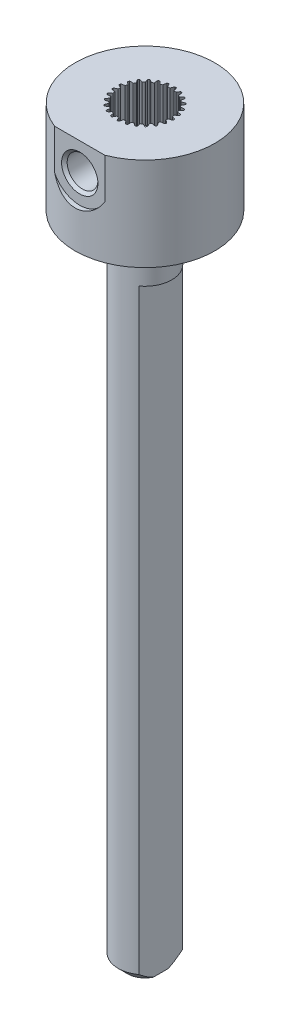
from build123d import *

# Parameters (mm, degrees)
SKETCH1_R               = 2.875
BOSS_EXTRUDE1_DEPTH     = 35
CHAMFER1_SIZE           = 1
SKETCH2_R               = 7.5
BOSS_EXTRUDE2_DEPTH     = 10
SKETCH3_R               = 2.5
CUT_EXTRUDE1_DEPTH      = 6
CUT_EXTRUDE3_DEPTH      = 3
CUT_EXTRUDE2_REACH      = 50.862
CUT_EXTRUDE2_END_RADIUS = 2.5
SKETCH4_R               = 1.65
CHAMFER2_SIZE           = 0.3
CUT_EXTRUDE4_REACH      = 82.7
SKETCH6_R               = 2
BOSS_EXTRUDE3_DEPTH     = 2.5
CUT_EXTRUDE5_START      = -65
CUT_EXTRUDE5_DEPTH      = 65


with BuildPart() as part:
    # Sketch1 → Boss-Extrude1 (new, symmetric)
    with BuildSketch(Plane(origin=(0, 0, 0), x_dir=(1, 0, 0), z_dir=(0, 1, 0))):
        with Locations(Location((0, 0, 0), (0, 0, 270))):
            Circle(SKETCH1_R)
    extrude(amount=BOSS_EXTRUDE1_DEPTH, both=True)

    # Chamfer1
    chamfer1_edges = [part.edges().sort_by_distance(p)[0] for p in [
        (0, -35, -2.875),
    ]]
    chamfer(chamfer1_edges, length=CHAMFER1_SIZE)

    # Sketch2 → Boss-Extrude2 (add)
    with BuildSketch(Plane(origin=(0, 35, 0), x_dir=(1, 0, 0), z_dir=(0, 1, 0))):
        with Locations(Location((0, 0, 0), (0, 0, 270))):
            Circle(SKETCH2_R)
    extrude(amount=BOSS_EXTRUDE2_DEPTH)

    # Sketch3 → Cut-Extrude1 (cut)
    with BuildSketch(Plane(origin=(0, 45, 0), x_dir=(1, 0, 0), z_dir=(0, 1, 0))):
        with Locations(Location((0, 0, 0), (0, 0, 270))):
            Circle(SKETCH3_R)
    extrude(amount=-CUT_EXTRUDE1_DEPTH, mode=Mode.SUBTRACT)

    # Sketch5 → Cut-Extrude3 (cut)
    with BuildSketch(Plane.XY.offset(10)):
        with BuildLine():
            Line((-3, 42), (-3, 45))
            Line((-3, 45), (3, 45))
            Line((3, 45), (3, 42))
            ThreePointArc((3, 42), (0, 39), (-3, 42))
        make_face()
    extrude(amount=-CUT_EXTRUDE3_DEPTH, mode=Mode.SUBTRACT)

    # Cut-Extrude2: up to this cylinder (the profile starts outside it)
    cut_extrude2_end = Plane(origin=(0, 42, 0), z_dir=(0, 1, 0)) * Cylinder(CUT_EXTRUDE2_END_RADIUS, 107.724, mode=Mode.PRIVATE)
    # Sketch4 → Cut-Extrude2 (cut, up to the surface)
    with BuildSketch(Plane.XY.offset(10), mode=Mode.PRIVATE) as cut_extrude2_sk1:
        with Locations((0, 42)):
            Circle(SKETCH4_R)
    cut_extrude2_tool1 = extrude(cut_extrude2_sk1.sketch, amount=-CUT_EXTRUDE2_REACH, mode=Mode.PRIVATE) - cut_extrude2_end
    add(cut_extrude2_tool1.solids().sort_by_distance((0, 42, 10))[0], mode=Mode.SUBTRACT)

    # Chamfer2
    chamfer2_edges = [part.edges().sort_by_distance(p)[0] for p in [
        (-1.65, 42, 7),
    ]]
    chamfer(chamfer2_edges, length=CHAMFER2_SIZE)

    # Cut-Extrude4: up to this face of the body (flat: up to its plane)
    cut_extrude4_end = Plane(part.part.faces().sort_by_distance((0, 39, 0))[0])
    # Sketch7 → Cut-Extrude4 (cut, up to the picked face)
    with BuildSketch(Plane(origin=(0, 45, 0), x_dir=(1, 0, 0), z_dir=(0, 1, 0)), mode=Mode.PRIVATE) as cut_extrude4_sk1:
        Polygon((2.739118864, 0.491293106), (2.792585596, 0.516945827), (2.825867273, 0.535938003), (2.851791156, 0.551403027), (2.897085891, 0.581198263), (2.914141718, 0.59350815), (2.964519237, 0.631435083), (2.99237072, 0.654993582), (3.037784492, 0.693915657), (3.024975426, 0.747757615), (3.011211008, 0.801362185), (2.996497184, 0.854716908), (2.937931607, 0.866950275), (2.902197706, 0.874172775), (2.839774932, 0.883139998), (2.818919353, 0.885707462), (2.764896975, 0.889992876), (2.734787159, 0.891050486), (2.696521666, 0.891653411), (2.637179346, 0.888390957), (2.595856806, 0.882788797), (2.565588962, 0.967204), (2.532576983, 1.05058342), (2.496855049, 1.132840442), (2.530800572, 1.157028788), (2.576209131, 1.195172525), (2.603721042, 1.221844593), (2.624981653, 1.243268006), (2.661447653, 1.283395257), (2.674902463, 1.299555537), (2.714268958, 1.348825164), (2.735384641, 1.378567498), (2.769692044, 1.427560741), (2.743895065, 1.476525632), (2.717232622, 1.525024646), (2.689712869, 1.573042496), (2.629959325, 1.570327587), (2.593535299, 1.56843561), (2.530852926, 1.561598152), (2.510006061, 1.558897381), (2.456617116, 1.549613642), (2.427184416, 1.543148737), (2.389975844, 1.534217696), (2.333309345, 1.516299887), (2.294679788, 1.500597398), (2.244368588, 1.574833227), (2.191657099, 1.647383907), (2.136601301, 1.71817224), (2.163464315, 1.750042634), (2.197960002, 1.798280546), (2.217975246, 1.830956705), (2.233242221, 1.856997777), (2.258580076, 1.904927859), (2.267597982, 1.923936334), (2.293470042, 1.981435367), (2.306527784, 2.015499509), (2.327572823, 2.071485409), (2.290409498, 2.112496464), (2.252523426, 2.152841318), (2.213927295, 2.192506603), (2.156731149, 2.175018667), (2.121914979, 2.164125797), (2.062904258, 2.141915176), (2.043382598, 2.134114239), (1.993980941, 2.111845282), (1.96708219, 2.09826458), (1.933262489, 2.080359972), (1.882832042, 2.048912536), (1.849320151, 2.024096608), (1.782128337, 2.083488162), (1.713030386, 2.140651069), (1.642100321, 2.195523492), (1.660193332, 2.233073249), (1.681608922, 2.288374426), (1.69286881, 2.325001537), (1.701179652, 2.354020218), (1.713802473, 2.406747315), (1.717806891, 2.427385004), (1.72857019, 2.489535841), (1.732744912, 2.525768525), (1.73920589, 2.585229066), (1.693011421, 2.615709872), (1.646282134, 2.645364996), (1.599034305, 2.674185621), (1.547984497, 2.643023188), (1.516971254, 2.623814234), (1.465340142, 2.587628096), (1.448365643, 2.575212848), (1.406059109, 2.541361299), (1.383380438, 2.521516103), (1.355075754, 2.495763885), (1.314050426, 2.452762859), (1.287763791, 2.420392392), (1.20791197, 2.46120836), (1.126769214, 2.499391193), (1.044422222, 2.534900251), (1.052608706, 2.575769965), (1.059599071, 2.634659357), (1.061396041, 2.672936268), (1.062228842, 2.703107688), (1.061341673, 2.757323837), (1.06008836, 2.778301487), (1.055057892, 2.841179002), (1.050090977, 2.87731256), (1.041562163, 2.936511971), (0.989237299, 2.954546664), (0.936600791, 2.971649283), (0.88366978, 2.987814191), (0.841967755, 2.944929204), (0.816712029, 2.918617285), (0.775698674, 2.870723035), (0.762352845, 2.854486157), (0.729787533, 2.811169541), (0.712758373, 2.786309548), (0.691748794, 2.754328105), (0.662705034, 2.702475508), (0.645295038, 2.664584693), (0.557802405, 2.684260147), (0.469712635, 2.701063972), (0.381121496, 2.714978326), (0.378886519, 2.756600112), (0.371012633, 2.815377818), (0.363233217, 2.852899854), (0.356537877, 2.882324575), (0.342194864, 2.934622778), (0.335759441, 2.954643126), (0.315257081, 3.014273642), (0.301459393, 3.048038741), (0.278473703, 3.103261556), (0.22330953, 3.107717041), (0.168073086, 3.111192129), (0.112784246, 3.113685917), (0.083059037, 3.061779342), (0.065140185, 3.030012911), (0.037323357, 2.973418692), (0.028437182, 2.954378197), (0.007665547, 2.904318417), (-0.00264529, 2.876007155), (-0.015041724, 2.839806421), (-0.030276373, 2.782360077), (-0.037717538, 2.741329555), (-0.127354803, 2.73862844), (-0.216855657, 2.732997428), (-0.306124341, 2.724442618), (-0.318639808, 2.764201177), (-0.340884708, 2.819174059), (-0.35775056, 2.853583596), (-0.371555403, 2.880423359), (-0.398449999, 2.927503745), (-0.409657112, 2.945287163), (-0.444354823, 2.997960127), (-0.466111181, 3.027226057), (-0.502109647, 3.0749999), (-0.556649583, 3.065596587), (-0.611013359, 3.055225978), (-0.665185618, 3.043891684), (-0.681067769, 2.986226274), (-0.690525098, 2.950996196), (-0.703391525, 2.889271211), (-0.70726488, 2.868610701), (-0.714934026, 2.814959516), (-0.717880642, 2.784972251), (-0.720885496, 2.746827261), (-0.721355256, 2.687396918), (-0.718357832, 2.64580517), (-0.804507135, 2.620897096), (-0.889796418, 2.593185149), (-0.974132631, 2.562698686), (-0.996141749, 2.598095938), (-1.031359228, 2.645809461), (-1.056252797, 2.674944255), (-1.0762956, 2.69750446), (-1.114059943, 2.736423286), (-1.129333652, 2.750857104), (-1.176039442, 2.793245895), (-1.204389641, 2.816181385), (-1.251139639, 2.853503287), (-1.301626999, 2.830831764), (-1.351705127, 2.807267247), (-1.40135686, 2.782816735), (-1.402399537, 2.72301658), (-1.402798344, 2.686532216), (-1.399910847, 2.6235676), (-1.398522916, 2.602569798), (-1.392611651, 2.54871645), (-1.388006305, 2.518927156), (-1.381429134, 2.481233576), (-1.367105093, 2.423553322), (-1.353858749, 2.384013413), (-1.431107063, 2.338463467), (-1.506825004, 2.290411628), (-1.580930407, 2.239909362), (-1.611050096, 2.268720953), (-1.657027768, 2.306177466), (-1.688384518, 2.328206625), (-1.713414326, 2.345077732), (-1.759655529, 2.373373144), (-1.778057426, 2.383565301), (-1.833826699, 2.413000409), (-1.867000101, 2.428169626), (-1.921554542, 2.452689008), (-1.964819355, 2.418173909), (-2.007462642, 2.382895678), (-2.04947353, 2.346865858), (-2.035611643, 2.288685153), (-2.026924959, 2.253249215), (-2.008467192, 2.192975329), (-2.001901333, 2.172984499), (-1.982784986, 2.122297617), (-1.970915337, 2.094586875), (-1.955171226, 2.059713083), (-1.926951344, 2.007407275), (-1.904289028, 1.972403518), (-1.967782451, 1.909073832), (-2.029170933, 1.843701545), (-2.088389488, 1.776356722), (-2.124728969, 1.796772385), (-2.178577816, 1.821618237), (-2.214426564, 1.835156245), (-2.242860549, 1.845270915), (-2.29469908, 1.861181682), (-2.315040092, 1.866472762), (-2.376389947, 1.881117224), (-2.412291041, 1.887559504), (-2.471228706, 1.897741458), (-2.504549081, 1.853551468), (-2.537079899, 1.808776537), (-2.568812104, 1.763430926), (-2.540916654, 1.710525383), (-2.5236879, 1.678359043), (-2.490834032, 1.624589104), (-2.47948815, 1.606835797), (-2.448372614, 1.562505094), (-2.429982552, 1.538614242), (-2.406060471, 1.508751522), (-2.365719018, 1.465107002), (-2.335065386, 1.436838941), (-2.380812725, 1.359708512), (-2.424014302, 1.281123347), (-2.464624977, 1.201167411), (-2.504899593, 1.211904455), (-2.563232834, 1.222578263), (-2.601323626, 1.226775624), (-2.63138128, 1.229501246), (-2.685546863, 1.232020393), (-2.706569519, 1.232086643), (-2.769628687, 1.231014012), (-2.805999492, 1.228325981), (-2.865624031, 1.223530313), (-2.886907699, 1.172441867), (-2.907280232, 1.120985084), (-2.926739658, 1.069171615), (-2.886562051, 1.024865652), (-2.861887544, 0.998007385), (-2.816646614, 0.954050803), (-2.801293047, 0.939724304), (-2.760101819, 0.904499694), (-2.736360499, 0.885943549), (-2.705763167, 0.862968239), (-2.655838615, 0.830726842), (-2.619114255, 0.810970836), (-2.644244599, 0.724886218), (-2.666547126, 0.638026691), (-2.685997175, 0.55048273), (-2.727677429, 0.550866441), (-2.786832748, 0.546697725), (-2.824774091, 0.541289946), (-2.854558016, 0.536456091), (-2.907651314, 0.525425216), (-2.928023218, 0.520262979), (-2.988842737, 0.503539419), (-3.023385674, 0.491896435), (-3.079958838, 0.47241864), (-3.087870645, 0.417642081), (-3.09480491, 0.362734619), (-3.100765532, 0.307710877), (-3.050833676, 0.274788251), (-3.020246792, 0.254904599), (-2.965522612, 0.223595991), (-2.947064623, 0.213524729), (-2.898415296, 0.18965448), (-2.870802977, 0.177584102), (-2.835454623, 0.16293983), (-2.779076299, 0.144127637), (-2.738595715, 0.134124922), (-2.741526289, 0.044495172), (-2.741526289, -0.045182672), (-2.738595711, -0.134812412), (-2.779060042, -0.144806157), (-2.835320922, -0.163555389), (-2.870725346, -0.178228975), (-2.898370577, -0.190317455), (-2.947054326, -0.214206015), (-2.965511869, -0.224277613), (-3.020248451, -0.255593011), (-3.050816031, -0.275464168), (-3.100765517, -0.308398387), (-3.094805012, -0.363421304), (-3.08787051, -0.418330666), (-3.079958817, -0.473106214), (-3.023407756, -0.492576784), (-2.988838324, -0.504228573), (-2.928043234, -0.520945389), (-2.907661311, -0.526109671), (-2.854609881, -0.537130547), (-2.824860006, -0.541955247), (-2.786979096, -0.547348366), (-2.727695497, -0.551549266), (-2.685997149, -0.55117024), (-2.666547126, -0.638714258), (-2.644244599, -0.725573786), (-2.619114264, -0.81165837), (-2.655824161, -0.831401593), (-2.705654761, -0.863553329), (-2.736297293, -0.886570225), (-2.760068256, -0.905154577), (-2.801283455, -0.940402777), (-2.816631115, -0.954724278), (-2.861889767, -0.998697173), (-2.886558077, -1.025548936), (-2.926739637, -1.069859028), (-2.90728079, -1.121671222), (-2.88690709, -1.173131068), (-2.865623998, -1.224217752), (-2.806006782, -1.229012961), (-2.769625687, -1.231701625), (-2.706584989, -1.232774244), (-2.685558169, -1.232707517), (-2.631432409, -1.230188708), (-2.601417301, -1.227463289), (-2.563384602, -1.223266264), (-2.504919495, -1.212591859), (-2.464624977, -1.20185496), (-2.424014302, -1.281810896), (-2.380812725, -1.360395948), (-2.335065386, -1.43752649), (-2.36570997, -1.465778575), (-2.405977359, -1.509312597), (-2.429930586, -1.539223626), (-2.448342518, -1.563148216), (-2.479481799, -1.607513871), (-2.490825484, -1.625264493), (-2.523688792, -1.679049099), (-2.540914133, -1.711209048), (-2.568812104, -1.764118362), (-2.537079899, -1.809463973), (-2.504549081, -1.854238791), (-2.471228706, -1.898428818), (-2.412292209, -1.888247295), (-2.376384033, -1.881803595), (-2.315060792, -1.867165875), (-2.294708731, -1.861871561), (-2.24290741, -1.845970314), (-2.214514934, -1.835866695), (-2.178720551, -1.822343277), (-2.124747059, -1.797464537), (-2.088389488, -1.777044271), (-2.029170933, -1.844389094), (-1.967782451, -1.909761232), (-1.904289028, -1.97309099), (-1.926945931, -2.008076844), (-1.95512425, -2.060257821), (-1.970886545, -2.095186297), (-1.982764721, -2.122924194), (-2.00190276, -2.173671613), (-2.008460647, -2.193641699), (-2.026925283, -2.253941132), (-2.035609796, -2.289368081), (-2.04947353, -2.347552879), (-2.007462642, -2.383582925), (-1.964819355, -2.41886093), (-1.921554542, -2.453376255), (-1.867001268, -2.428857742), (-1.833823555, -2.413686499), (-1.778063116, -2.384255175), (-1.759676922, -2.37407124), (-1.713451228, -2.345784131), (-1.688464568, -2.328937324), (-1.657159662, -2.306937209), (-1.611067244, -2.269417371), (-1.580930407, -2.240596609), (-1.506825004, -2.291098649), (-1.431107063, -2.339150488), (-1.353858749, -2.384700434), (-1.367103288, -2.424221757), (-1.38142019, -2.481771445), (-1.388000191, -2.51952056), (-1.392608331, -2.549354092), (-1.398521924, -2.603243782), (-1.399909112, -2.62423702), (-1.402797749, -2.687224003), (-1.402398953, -2.723702128), (-1.401356858, -2.783503758), (-1.351705127, -2.807954268), (-1.301626999, -2.83151901), (-1.251139639, -2.854190534), (-1.204398287, -2.816875696), (-1.176033979, -2.793928335), (-1.129353638, -2.751563594), (-1.114067132, -2.737117374), (-1.076331239, -2.698225157), (-1.056319137, -2.675694088), (-1.031467634, -2.646599693), (-0.996155291, -2.59879597), (-0.974132631, -2.563385933), (-0.889796418, -2.59387217), (-0.804507135, -2.621584117), (-0.718357832, -2.646492191), (-0.72135887, -2.688065797), (-0.7209126, -2.747366845), (-0.717898402, -2.785567188), (-0.714943592, -2.815603787), (-0.707268307, -2.869282752), (-0.703393992, -2.889945363), (-0.690524045, -2.951686221), (-0.681066924, -2.986914977), (-0.665185618, -3.044578705), (-0.611013359, -3.055913224), (-0.556649583, -3.066283608), (-0.502109647, -3.075687147), (-0.466116184, -3.027920556), (-0.444349801, -2.998640577), (-0.409671004, -2.945996551), (-0.39845747, -2.928202516), (-0.371581199, -2.881151404), (-0.357799773, -2.854348712), (-0.340965109, -2.819988231), (-0.318648838, -2.764904376), (-0.306124341, -2.725130091), (-0.216855657, -2.733684675), (-0.127354803, -2.739315687), (-0.037717538, -2.742016576), (-0.030285406, -2.783030317), (-0.015105864, -2.840357709), (-0.002685951, -2.876607974), (0.007646827, -2.904967926), (0.028427973, -2.95504636), (0.037325705, -2.974110323), (0.065138508, -3.030696684), (0.083061455, -3.062470512), (0.112784246, -3.114372938), (0.168073086, -3.111879376), (0.22330953, -3.108404513), (0.278473703, -3.103948803), (0.301457023, -3.048731665), (0.315257502, -3.014959344), (0.335756015, -2.955342092), (0.342190961, -2.935322117), (0.356522896, -2.883061306), (0.363205428, -2.853675594), (0.370966561, -2.8162078), (0.378881099, -2.757305351), (0.381121488, -2.715665574), (0.469712635, -2.701751219), (0.557802405, -2.684947394), (0.645295038, -2.66527194), (0.662694199, -2.703148238), (0.691653939, -2.754899493), (0.712697851, -2.786922265), (0.729758101, -2.811821143), (0.762344142, -2.855162317), (0.775692716, -2.871401867), (0.816713211, -2.919305265), (0.841973105, -2.945621378), (0.88366978, -2.988501212), (0.936600791, -2.97233653), (0.989237299, -2.955233911), (1.04156214, -2.937199226), (1.050090978, -2.878001253), (1.05505826, -2.841864293), (1.060087999, -2.778999924), (1.061340625, -2.758027251), (1.062225756, -2.703841814), (1.06139019, -2.67371728), (1.059589157, -2.63549692), (1.052606899, -2.576476104), (1.044422222, -2.535587724), (1.126769214, -2.500078666), (1.20791197, -2.461895607), (1.287763791, -2.421079638), (1.314035985, -2.453439206), (1.354954701, -2.4963626), (1.383302039, -2.522145785), (1.40602005, -2.542020735), (1.448355397, -2.575892854), (1.465330582, -2.588308008), (1.51697201, -2.624502036), (1.547983288, -2.643709606), (1.599034305, -2.674872868), (1.646282134, -2.646052243), (1.693011421, -2.616397119), (1.739205875, -2.585916396), (1.732745192, -2.526454439), (1.728569527, -2.490216257), (1.717810747, -2.428091988), (1.713805418, -2.407451157), (1.701187044, -2.354750252), (1.692886961, -2.325782172), (1.681637831, -2.289208925), (1.660197844, -2.233778931), (1.642100321, -2.196210738), (1.713030386, -2.141338316), (1.782128337, -2.084175634), (1.849320151, -2.024783629), (1.882813995, -2.049593173), (1.933122465, -2.080991661), (1.966990868, -2.098915197), (1.993939005, -2.112516652), (2.043365464, -2.134795087), (2.062904242, -2.142602271), (2.121913364, -2.164812362), (2.156729959, -2.175705316), (2.213927295, -2.193193624), (2.252523426, -2.153528339), (2.290409498, -2.113183711), (2.327572823, -2.072172656), (2.306526818, -2.016184165), (2.29347122, -1.982125586), (2.267598584, -1.924624464), (2.258585956, -1.905628517), (2.233264101, -1.857730626), (2.218016898, -1.831730003), (2.198025046, -1.79910349), (2.16347336, -1.750747097), (2.136601301, -1.718859789), (2.191657099, -1.648071456), (2.244368588, -1.575520663), (2.294679788, -1.501284947), (2.333290348, -1.516985017), (2.389827689, -1.534886048), (2.427089179, -1.54382388), (2.456572992, -1.550296304), (2.509988115, -1.559583009), (2.530844918, -1.562284648), (2.593535782, -1.569123234), (2.629963712, -1.571015193), (2.689712869, -1.573729969), (2.717232622, -1.525712082), (2.743895065, -1.477213068), (2.769692044, -1.428248178), (2.735383766, -1.379253295), (2.714266392, -1.349509133), (2.674912323, -1.300255222), (2.661456505, -1.284094384), (2.62501255, -1.24399325), (2.603781913, -1.222605389), (2.576303986, -1.195975256), (2.530812334, -1.157730766), (2.496855049, -1.133527878), (2.532576641, -1.051271758), (2.565588962, -0.96789155), (2.595856806, -0.883476308), (2.637160375, -0.889080839), (2.696372607, -0.892359385), (2.734686702, -0.891749653), (2.764852984, -0.890686404), (2.818901143, -0.886397481), (2.839773992, -0.883827419), (2.902195848, -0.874860564), (2.937950086, -0.867633846), (2.996497184, -0.855404437), (3.011210581, -0.802051246), (3.024975797, -0.748443737), (3.03778447, -0.694603205), (2.992360019, -0.655671836), (2.964521143, -0.632124054), (2.914142606, -0.594195886), (2.897101647, -0.58189732), (2.851823662, -0.552115308), (2.825948552, -0.536683454), (2.792708456, -0.517721248), (2.739134237, -0.491991548), (2.700224615, -0.476993917), (2.714368076, -0.388437877), (2.725607932, -0.29946741), (2.733931655, -0.210177252), (2.775330986, -0.205334023), (2.833498001, -0.193784019), (2.870456495, -0.183665214), (2.89940973, -0.175133607), (2.950694865, -0.157537456), (2.970270529, -0.149858127), (3.028502212, -0.125649185), (3.061336482, -0.109757556), (3.115002952, -0.083352188), (3.115985833, -0.02801622), (3.115985833, 0.027328598), (3.115002954, 0.082664688), (3.061322474, 0.109077264), (3.028503665, 0.124961345), (2.97027531, 0.149169197), (2.950711153, 0.156843455), (2.899450861, 0.174429261), (2.870550052, 0.182941594), (2.833637122, 0.193041656), (2.775348147, 0.204639667), (2.733931667, 0.209489759), (2.725607932, 0.298779919), (2.714368087, 0.387750285), (2.700224632, 0.476306404), align=None)
    cut_extrude4_tool1 = split(extrude(cut_extrude4_sk1.sketch, amount=-CUT_EXTRUDE4_REACH, mode=Mode.PRIVATE), bisect_by=cut_extrude4_end, keep=Keep.BOTH, mode=Mode.PRIVATE)
    add(cut_extrude4_tool1.solids().sort_by(Axis((3.9e-05, 45, 0.000344), (0, -1, 0)))[0], mode=Mode.SUBTRACT)

    # Sketch6 → Boss-Extrude3 (add)
    with BuildSketch(Plane(origin=(0, 39, 0), x_dir=(1, 0, 0), z_dir=(0, 1, 0))):
        with Locations(Location((0, 0, 0), (0, 0, 270))):
            Circle(SKETCH6_R)
    extrude(amount=BOSS_EXTRUDE3_DEPTH)

    # Sketch8 → Cut-Extrude5 (cut)
    with BuildSketch(Plane.XZ.offset(35).offset(CUT_EXTRUDE5_START)):
        with BuildLine():
            Line((1.7, 2.318539411), (1.7, -2.318539411))
            ThreePointArc((1.7, -2.318539411), (2.875, 0), (1.7, 2.318539411))
        make_face()
    extrude(amount=CUT_EXTRUDE5_DEPTH, mode=Mode.SUBTRACT)


solid = part.part
